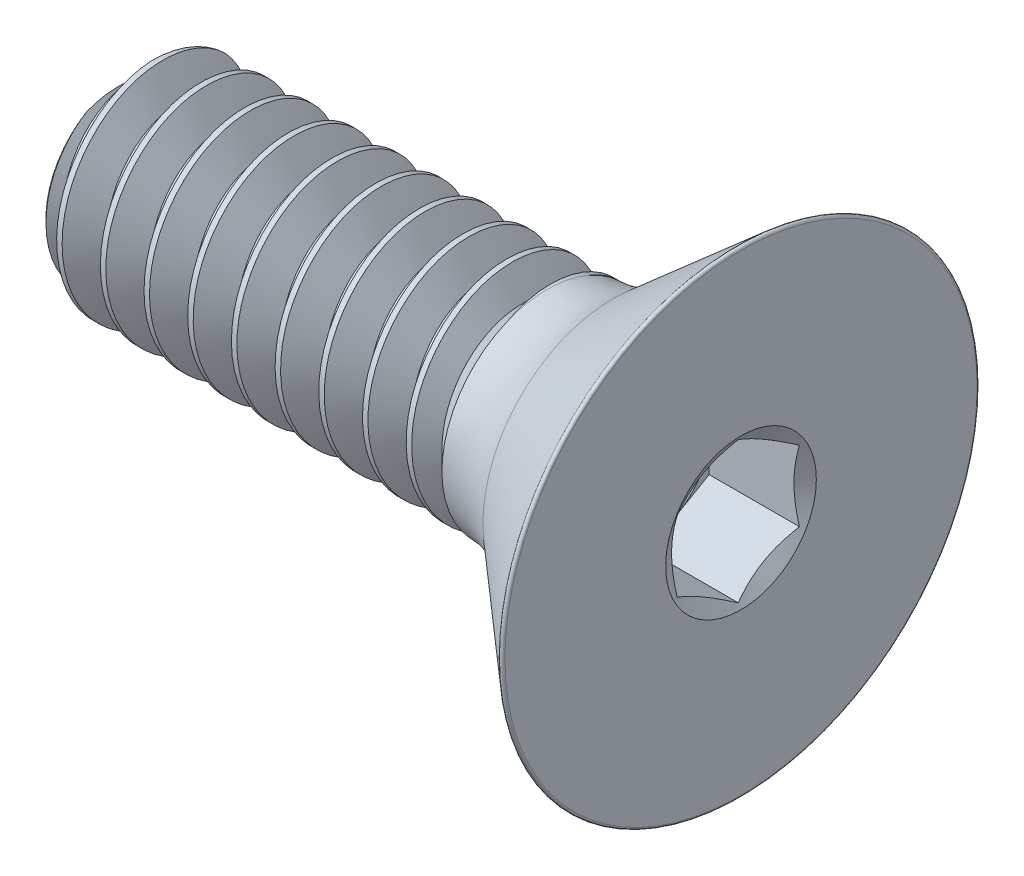
from build123d import *

# Parameters (mm, degrees)
CUT_EXTRUDE1_DEPTH = 0.9652
FILLET1_R          = 0.025019
DELETEFACE1_START  = 1
DELETEFACE1_DEPTH  = 1.2098
CUT_SWEEP1_PITCH   = 0.453571429
CUT_SWEEP1_TO      = 4.33724


with BuildPart() as part:
    # Sketch3 → Revolve1 (revolve)
    with BuildSketch(Plane.XY, mode=Mode.PRIVATE) as revolve1_sk:
        with BuildLine():
            Line((-2.948214286, 1.0922), (-3.175, 0.865414286))
            Line((-3.175, 0.865414286), (-3.175, 0))
            Line((-3.175, 0), (3.175, 0))
            Line((3.175, 0), (3.175, 2.505312521))
            Line((3.175, 2.505312521), (1.841593575, 1.3462))
            ThreePointArc((1.841593575, 1.3462), (1.524881987, 1.157776405), (1.162239716, 1.0922))
            Line((1.162239716, 1.0922), (-2.948214286, 1.0922))
        make_face()
    revolve(revolve1_sk.sketch.rotate(Axis((3.175, 0, 0), (-1, 0, 0)), 90), axis=Axis((3.175, 0, 0), (-1, 0, 0)))

    # Sketch4 → Cut-Extrude1 (cut)
    with BuildSketch(Plane(origin=(3.175, 0, 0), x_dir=(0, 0, -1), z_dir=(1, 0, 0))):
        Polygon((0, 0.733234842), (-0.635, 0.366617421), (-0.635, -0.366617421), (0, -0.733234842), (0.635, -0.366617421), (0.635, 0.366617421), align=None)
    extrude(amount=-CUT_EXTRUDE1_DEPTH, mode=Mode.SUBTRACT)

    # Cut-Extrude2 cone 1 section (through the dimple's axis) → Cut-Extrude2 (revolve, cut)
    with BuildSketch(Plane(origin=(3.175, 0, 0), x_dir=(0, 0, -1), z_dir=(0, 1, 0))):
        Polygon((0, 0), (0.782352263, 0), (0, 0.45169129), align=None)
    revolve(axis=Axis((3.175, 0, 0), (-1, 0, 0)), mode=Mode.SUBTRACT)

    # Cut-Extrude3 cone 1 section (through the dimple's axis) → Cut-Extrude3 (revolve, cut)
    with BuildSketch(Plane(origin=(2.2098, 0, 0), x_dir=(0, 0, -1), z_dir=(0, 1, 0))):
        Polygon((0, 0), (0.635, 0), (0, 0.366617421), align=None)
    revolve(axis=Axis((2.2098, 0, 0), (-1, 0, 0)), mode=Mode.SUBTRACT)

    # Fillet1
    fillet1_edges = [part.edges().sort_by_distance(p)[0] for p in [
        (3.175, 0, 2.505312521),
    ]]
    fillet(fillet1_edges, radius=FILLET1_R)

    # DeleteFace1: read off the stored shape, not the designer's step
    # DeleteFace1 outline → DeleteFace1 (add)
    with BuildSketch(Plane.YZ.offset(DELETEFACE1_START)):
        Polygon((-0.366617421, -0.635), (0.366617421, -0.635), (0.733234842, 0), (0.366617421, 0.635), (-0.366617421, 0.635), (-0.733234842, 0), align=None)
    extrude(amount=DELETEFACE1_DEPTH)


with BuildPart() as body_2:
    # Split1: the piece on the far side of the plane
    add(part.part)
    split(bisect_by=Plane(origin=(1.162239716, 0, 0), x_dir=(0, 0, 1), z_dir=(1, 0, 0)), keep=Keep.BOTTOM)

    # Cut-Sweep1: arcs per turn and ends read off the stored shape
    # Cut-Sweep1: the profile of Sketch7 screwed along a right-hand helix through 14 turns, 6 arcs to a turn; built about Z, then put on its axis
    cut_sweep1_z = Axis((0, 0, 0), (0, 0, 1))
    cut_sweep1_corners = [(0.797596715, 0, -0.226785714), (1.116750274, 0, -0.411049107), (1.116750274, 0, 0.014174107), (0.797596715, 0, -0.170089286)]
    with BuildLine(mode=Mode.PRIVATE) as cut_sweep1_profile:
        Line(cut_sweep1_corners[0], cut_sweep1_corners[1])
        Line(cut_sweep1_corners[1], cut_sweep1_corners[2])
        Line(cut_sweep1_corners[2], cut_sweep1_corners[3])
        Line(cut_sweep1_corners[3], cut_sweep1_corners[0])
    cut_sweep1_cap = Face(cut_sweep1_profile.wire())
    cut_sweep1_turn_angles = [0, 30, 60, 90, 120, 150, 180, 210, 240, 270, 300, 330, 360]
    cut_sweep1_turn_weights = [1, 0.8660254037844387, 1, 0.8660254037844387, 1, 0.8660254037844387, 1, 0.8660254037844387, 1, 0.8660254037844387, 1, 0.8660254037844387, 1]
    cut_sweep1_turn_rails = [Edge.make_bspline([Vector(p[0], p[1], 0).rotate(cut_sweep1_z, cut_sweep1_turn_angles[k]) / cut_sweep1_turn_weights[k] + Vector(0, 0, p[2] + CUT_SWEEP1_PITCH * cut_sweep1_turn_angles[k] / 360) for k in range(13)], [0, 0, 0, 1, 1, 2, 2, 3, 3, 4, 4, 5, 5, 6, 6, 6], 2, cut_sweep1_turn_weights) for p in cut_sweep1_corners]
    cut_sweep1_turn_sides = [Face.make_surface_from_curves(cut_sweep1_turn_rails[p[0]], cut_sweep1_turn_rails[p[1]]) for p in [(0, 1), (1, 2), (2, 3), (3, 0)]]
    cut_sweep1 = Plane(origin=(-3.175, 0, 0), x_dir=(0, -1, 0), z_dir=(1, 0, 0)) * split(Solid(Shell([*[p.moved(Location((0, 0, CUT_SWEEP1_PITCH * i))) for i in range(14) for p in cut_sweep1_turn_sides], cut_sweep1_cap, cut_sweep1_cap.rotate(cut_sweep1_z, 5040).moved(Location((0, 0, CUT_SWEEP1_PITCH * 5040 / 360)))])), bisect_by=Plane.XY.offset(CUT_SWEEP1_TO), keep=Keep.BOTTOM, mode=Mode.PRIVATE)
    add(cut_sweep1, mode=Mode.SUBTRACT)


with BuildPart() as part_1:
    add(part.part)

    # Split1
    split(bisect_by=Plane(origin=(1.162239716, 0, 0), x_dir=(0, 0, 1), z_dir=(1, 0, 0)), keep=Keep.TOP)

    add(body_2.part)  # Revolve2 merges body 2
    # Sketch9 → Revolve2 (revolve)
    with BuildSketch(Plane.XY, mode=Mode.PRIVATE) as revolve2_sk:
        with BuildLine():
            Line((1.162239716, 1.0922), (1.162239716, 0))
            Line((1.162239716, 0), (1.841593575, 0))
            Line((1.841593575, 0), (1.841593575, 1.3462))
            ThreePointArc((1.841593575, 1.3462), (1.524881987, 1.157776405), (1.162239716, 1.0922))
        make_face()
    revolve(revolve2_sk.sketch.rotate(Axis((1.162239716, 0, 0), (1, 0, 0)), 22.79092502), axis=Axis((1.162239716, 0, 0), (1, 0, 0)))

    # Cut-Extrude4 cone 1 section (through the dimple's axis) → Cut-Extrude4 (revolve, cut)
    with BuildSketch(Plane(origin=(2.2098, 0, 0), x_dir=(0, 0, -1), z_dir=(0, 1, 0))):
        Polygon((0, 0), (0.635, 0), (0, 0.366617421), align=None)
    revolve(axis=Axis((2.2098, 0, 0), (-1, 0, 0)), mode=Mode.SUBTRACT)

    # Boss-Extrude1: read off the stored shape, not the designer's step
    # Boss-Extrude1 outline → Boss-Extrude1 (revolve)
    with BuildSketch(Plane.YX):
        Polygon((0.797593164, 1.162239948), (0.797593164, 0.86763288), (1.092200232, 1.162239948), align=None)
    revolve(axis=Axis((0, 0, 0), (1, 0, 0)))


solid = part_1.part
